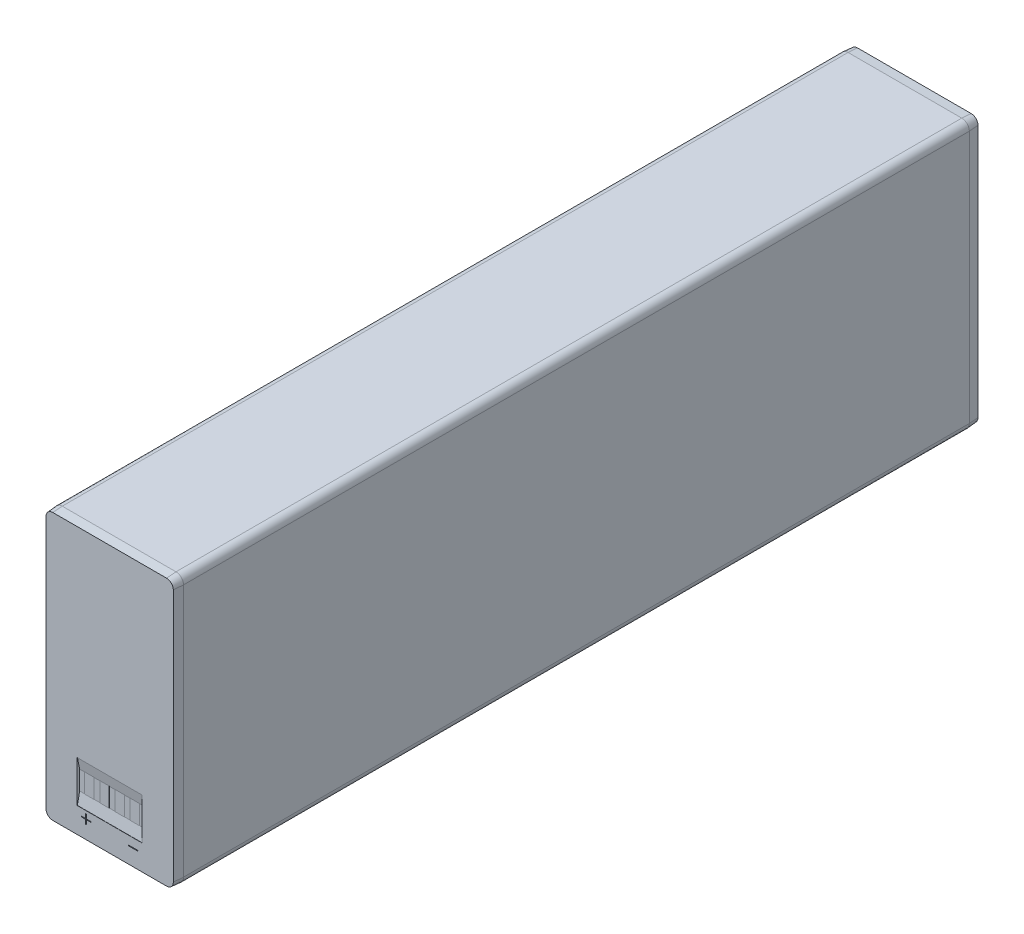
from build123d import *
from OCP.BRepFilletAPI import BRepFilletAPI_MakeChamfer

# Parameters (mm, degrees)
ESQUISSE1_W             = 34.1
ESQUISSE1_H             = 71
EXTRUSION1_DEPTH        = 213
ESQUISSE2_W             = 14.6
ESQUISSE2_H             = 6
ENL_V_MAT_EXTRU_1_DEPTH = 0.65
SKETCH1_W               = 2.5
SKETCH1_H               = 0.2
CUT_EXTRUDE1_DEPTH      = 1
SKETCH2_W               = 17.2
SKETCH2_H               = 11
SKETCH2_W_2             = 14.6
SKETCH2_H_2             = 6
SKETCH2_W_3             = 1.53333333
CUT_EXTRUDE2_DEPTH      = 0.66
CHAMFER1_SIZE           = 0.6
CHAMFER1_SIZE_2         = 3
FILLET1_R               = 2
CHAMFER2_SIZE           = 2.5
CHAMFER2_SIZE2          = 0.2
CHAMFER3_SIZE           = 2.5
CHAMFER3_SIZE2          = 0.2


with BuildPart() as part:
    # Esquisse1 → Extrusion1 (new body)
    with BuildSketch(Plane.XY):
        Rectangle(ESQUISSE1_W, ESQUISSE1_H)
    extrude(amount=EXTRUSION1_DEPTH)

    # Esquisse2 → Enlèv. mat.-Extru.1 (cut)
    with BuildSketch(Plane.XY.offset(213)):
        with Locations((0, -23.15)):
            Rectangle(ESQUISSE2_W, ESQUISSE2_H)
    extrude(amount=-ENL_V_MAT_EXTRU_1_DEPTH, mode=Mode.SUBTRACT)

    # Sketch1 → Cut-Extrude1 (cut)
    with BuildSketch(Plane.XY.offset(213)):
        Polygon((-6.35, -29.35), (-6.15, -29.35), (-6.15, -30.5), (-5, -30.5), (-5, -30.7), (-6.15, -30.7), (-6.15, -31.85), (-6.35, -31.85), (-6.35, -30.7), (-7.5, -30.7), (-7.5, -30.5), (-6.35, -30.5), align=None)
        with Locations((6.25, -31)):
            Rectangle(SKETCH1_W, SKETCH1_H)
    extrude(amount=-CUT_EXTRUDE1_DEPTH, mode=Mode.SUBTRACT)

    # Sketch2 → Cut-Extrude2 (cut)
    # profile 1 of 4: a face of its own
    with BuildSketch(Plane.XY.offset(213)):
        with Locations((0, -23.15)):
            Rectangle(SKETCH2_W, SKETCH2_H)
        with Locations((0, -23.15)):
            Rectangle(SKETCH2_W_2, SKETCH2_H_2, mode=Mode.SUBTRACT)
    # profile 2 of 4: a face of its own
    with BuildSketch(Plane.XY.offset(213)):
        with Locations((-4.033333335, -23.15)):
            Rectangle(SKETCH2_W_3, SKETCH2_H_2)
    # profile 3 of 4: a face of its own
    with BuildSketch(Plane.XY.offset(213)):
        with Locations((-5e-09, -23.15)):
            Rectangle(SKETCH2_W_3, SKETCH2_H_2)
    # profile 4 of 4: a face of its own
    with BuildSketch(Plane.XY.offset(213)):
        with Locations((4.033333325, -23.15)):
            Rectangle(SKETCH2_W_3, SKETCH2_H_2)
    extrude(amount=-CUT_EXTRUDE2_DEPTH, mode=Mode.SUBTRACT)

    # Chamfer1
    # the kernel refuses this chamfer: 3, 0.6 mm, written as the material it adds along each edge
    with BuildSketch(Plane(origin=(-16.394396259, -17.65, 212.34), x_dir=(0, 0.18544098588999497, 0.9826554028509418), z_dir=(1, 0, 0)), Plane(origin=(16.394396259, -28.65, 212.34), x_dir=(0, -0.18544098588999497, 0.9826554028509418), z_dir=(-1, 0, 0))) as chamfer1_piece_1:
        Polygon((CHAMFER1_SIZE * 0.982655402851, CHAMFER1_SIZE * 0.18544098589), (-CHAMFER1_SIZE_2 * 0.18544098589, CHAMFER1_SIZE_2 * 0.982655402851), (0, 0), align=None)
    extrude(amount=32.788792518)

    # Fillet1
    fillet1_edges = [part.edges().sort_by_distance(p)[0] for p in [
        (-17.05, 35.5, 106.5),
        (17.05, 35.5, 106.5),
        (17.05, -35.5, 106.5),
        (-17.05, -35.5, 106.5),
    ]]
    fillet(fillet1_edges, radius=FILLET1_R)

    # Chamfer2: one chamfer whose edges measure the first distance from different faces: ONE call of the kernel's chamfer builder (chamfer() names one face for all edges)
    chamfer2_edges_1 = [part.edges().sort_by_distance(p)[0] for p in [
        (0, -35.5, 213),
    ]]
    chamfer2_side_1 = [part.faces().sort_by_distance(p)[0] for p in [
        (0, -35.5, 106.5),
    ]]
    chamfer2_edges_2 = [part.edges().sort_by_distance(p)[0] for p in [
        (-17.05, 0, 213),
    ]]
    chamfer2_side_2 = [part.faces().sort_by_distance(p)[0] for p in [
        (-17.05, 0, 106.5),
    ]]
    chamfer2_edges_3 = [part.edges().sort_by_distance(p)[0] for p in [
        (17.05, 0, 213),
    ]]
    chamfer2_side_3 = [part.faces().sort_by_distance(p)[0] for p in [
        (17.05, 0, 106.5),
    ]]
    chamfer2_edges_4 = [part.edges().sort_by_distance(p)[0] for p in [
        (0, 35.5, 213),
    ]]
    chamfer2_side_4 = [part.faces().sort_by_distance(p)[0] for p in [
        (0, 35.5, 106.5),
    ]]
    chamfer2_edges_5 = [part.edges().sort_by_distance(p)[0] for p in [
        (-16.464213562, 34.914213562, 213),
    ]]
    chamfer2_side_5 = [part.faces().sort_by_distance(p)[0] for p in [
        (-16.464213562, 34.914213562, 106.5),
    ]]
    chamfer2_edges_6 = [part.edges().sort_by_distance(p)[0] for p in [
        (16.464213562, 34.914213562, 213),
    ]]
    chamfer2_side_6 = [part.faces().sort_by_distance(p)[0] for p in [
        (16.464213562, 34.914213562, 106.5),
    ]]
    chamfer2_edges_7 = [part.edges().sort_by_distance(p)[0] for p in [
        (16.464213562, -34.914213562, 213),
    ]]
    chamfer2_side_7 = [part.faces().sort_by_distance(p)[0] for p in [
        (16.464213562, -34.914213562, 106.5),
    ]]
    chamfer2_edges_8 = [part.edges().sort_by_distance(p)[0] for p in [
        (-16.464213562, -34.914213562, 213),
    ]]
    chamfer2_side_8 = [part.faces().sort_by_distance(p)[0] for p in [
        (-16.464213562, -34.914213562, 106.5),
    ]]
    chamfer2 = BRepFilletAPI_MakeChamfer(part.part.solid().wrapped)
    for e in chamfer2_edges_1:
        chamfer2.Add(CHAMFER2_SIZE, CHAMFER2_SIZE2, e.wrapped, chamfer2_side_1[0].wrapped)  # the first distance lies on this face
    for e in chamfer2_edges_2:
        chamfer2.Add(CHAMFER2_SIZE, CHAMFER2_SIZE2, e.wrapped, chamfer2_side_2[0].wrapped)  # the first distance lies on this face
    for e in chamfer2_edges_3:
        chamfer2.Add(CHAMFER2_SIZE, CHAMFER2_SIZE2, e.wrapped, chamfer2_side_3[0].wrapped)  # the first distance lies on this face
    for e in chamfer2_edges_4:
        chamfer2.Add(CHAMFER2_SIZE, CHAMFER2_SIZE2, e.wrapped, chamfer2_side_4[0].wrapped)  # the first distance lies on this face
    for e in chamfer2_edges_5:
        chamfer2.Add(CHAMFER2_SIZE, CHAMFER2_SIZE2, e.wrapped, chamfer2_side_5[0].wrapped)  # the first distance lies on this face
    for e in chamfer2_edges_6:
        chamfer2.Add(CHAMFER2_SIZE, CHAMFER2_SIZE2, e.wrapped, chamfer2_side_6[0].wrapped)  # the first distance lies on this face
    for e in chamfer2_edges_7:
        chamfer2.Add(CHAMFER2_SIZE, CHAMFER2_SIZE2, e.wrapped, chamfer2_side_7[0].wrapped)  # the first distance lies on this face
    for e in chamfer2_edges_8:
        chamfer2.Add(CHAMFER2_SIZE, CHAMFER2_SIZE2, e.wrapped, chamfer2_side_8[0].wrapped)  # the first distance lies on this face
    add(Compound.cast(chamfer2.Shape()), mode=Mode.REPLACE)

    # Chamfer3: one chamfer whose edges measure the first distance from different faces: ONE call of the kernel's chamfer builder (chamfer() names one face for all edges)
    chamfer3_edges_1 = [part.edges().sort_by_distance(p)[0] for p in [
        (0, -35.5, 0),
    ]]
    chamfer3_side_1 = [part.faces().sort_by_distance(p)[0] for p in [
        (0, -35.5, 105.25),
    ]]
    chamfer3_edges_2 = [part.edges().sort_by_distance(p)[0] for p in [
        (-17.05, 0, 0),
    ]]
    chamfer3_side_2 = [part.faces().sort_by_distance(p)[0] for p in [
        (-17.05, 0, 105.25),
    ]]
    chamfer3_edges_3 = [part.edges().sort_by_distance(p)[0] for p in [
        (0, 35.5, 0),
    ]]
    chamfer3_side_3 = [part.faces().sort_by_distance(p)[0] for p in [
        (0, 35.5, 105.25),
    ]]
    chamfer3_edges_4 = [part.edges().sort_by_distance(p)[0] for p in [
        (17.05, 0, 0),
    ]]
    chamfer3_side_4 = [part.faces().sort_by_distance(p)[0] for p in [
        (17.05, 0, 105.25),
    ]]
    chamfer3_edges_5 = [part.edges().sort_by_distance(p)[0] for p in [
        (-16.464213562, 34.914213562, 0),
    ]]
    chamfer3_side_5 = [part.faces().sort_by_distance(p)[0] for p in [
        (-16.464213562, 34.914213562, 105.25),
    ]]
    chamfer3_edges_6 = [part.edges().sort_by_distance(p)[0] for p in [
        (16.464213562, 34.914213562, 0),
    ]]
    chamfer3_side_6 = [part.faces().sort_by_distance(p)[0] for p in [
        (16.464213562, 34.914213562, 105.25),
    ]]
    chamfer3_edges_7 = [part.edges().sort_by_distance(p)[0] for p in [
        (16.464213562, -34.914213562, 0),
    ]]
    chamfer3_side_7 = [part.faces().sort_by_distance(p)[0] for p in [
        (16.464213562, -34.914213562, 105.25),
    ]]
    chamfer3_edges_8 = [part.edges().sort_by_distance(p)[0] for p in [
        (-16.464213562, -34.914213562, 0),
    ]]
    chamfer3_side_8 = [part.faces().sort_by_distance(p)[0] for p in [
        (-16.464213562, -34.914213562, 105.25),
    ]]
    chamfer3 = BRepFilletAPI_MakeChamfer(part.part.solid().wrapped)
    for e in chamfer3_edges_1:
        chamfer3.Add(CHAMFER3_SIZE, CHAMFER3_SIZE2, e.wrapped, chamfer3_side_1[0].wrapped)  # the first distance lies on this face
    for e in chamfer3_edges_2:
        chamfer3.Add(CHAMFER3_SIZE, CHAMFER3_SIZE2, e.wrapped, chamfer3_side_2[0].wrapped)  # the first distance lies on this face
    for e in chamfer3_edges_3:
        chamfer3.Add(CHAMFER3_SIZE, CHAMFER3_SIZE2, e.wrapped, chamfer3_side_3[0].wrapped)  # the first distance lies on this face
    for e in chamfer3_edges_4:
        chamfer3.Add(CHAMFER3_SIZE, CHAMFER3_SIZE2, e.wrapped, chamfer3_side_4[0].wrapped)  # the first distance lies on this face
    for e in chamfer3_edges_5:
        chamfer3.Add(CHAMFER3_SIZE, CHAMFER3_SIZE2, e.wrapped, chamfer3_side_5[0].wrapped)  # the first distance lies on this face
    for e in chamfer3_edges_6:
        chamfer3.Add(CHAMFER3_SIZE, CHAMFER3_SIZE2, e.wrapped, chamfer3_side_6[0].wrapped)  # the first distance lies on this face
    for e in chamfer3_edges_7:
        chamfer3.Add(CHAMFER3_SIZE, CHAMFER3_SIZE2, e.wrapped, chamfer3_side_7[0].wrapped)  # the first distance lies on this face
    for e in chamfer3_edges_8:
        chamfer3.Add(CHAMFER3_SIZE, CHAMFER3_SIZE2, e.wrapped, chamfer3_side_8[0].wrapped)  # the first distance lies on this face
    add(Compound.cast(chamfer3.Shape()), mode=Mode.REPLACE)


solid = part.part
